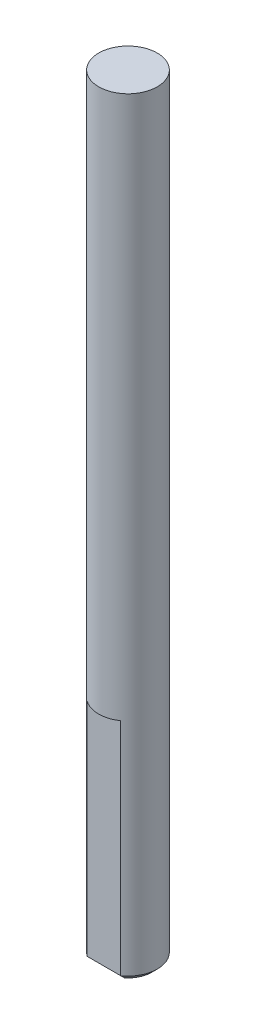
from build123d import *

# Parameters (mm, degrees)
BOSS_EXTRUDE1_DEPTH = 69
CUT_EXTRUDE1_DEPTH  = 20.3
CHAMFER1_SIZE       = 0.5


with BuildPart() as part:
    # Sketch1 → Boss-Extrude1 (new body)
    with BuildSketch(Plane(origin=(0, 0, 0), x_dir=(1, 0, 0), z_dir=(0, 1, 0))):
        with BuildLine():
            ThreePointArc((2.625, 0), (-1.215138881, 2.326813809), (-1.5, -2.154210992))
            Line((-1.5, -2.154210992), (1.5, -2.154210992))
            ThreePointArc((1.5, -2.154210992), (2.326813809, -1.215138881), (2.625, 0))
        make_face()
        with BuildLine():
            Line((1.5, -2.154210992), (-1.5, -2.154210992))
            ThreePointArc((-1.5, -2.154210992), (0, -2.625), (1.5, -2.154210992))
        make_face()
    extrude(amount=BOSS_EXTRUDE1_DEPTH)

    # Sketch1<3> → Cut-Extrude1 (cut)
    with BuildSketch(Plane(origin=(0, 0, 0), x_dir=(1, 0, 0), z_dir=(0, 1, 0))):
        with BuildLine():
            Line((1.5, -2.154210992), (-1.5, -2.154210992))
            ThreePointArc((-1.5, -2.154210992), (0, -2.625), (1.5, -2.154210992))
        make_face()
    extrude(amount=CUT_EXTRUDE1_DEPTH, mode=Mode.SUBTRACT)

    # Chamfer1
    # the kernel refuses this chamfer: 0.5 mm, written as the material it takes off along each edge
    with BuildSketch(Plane(origin=(2.785841494, 0, 2.154210992), x_dir=(0, 0.9996219169112968, 0.027495876610586494), z_dir=(-1, 0, 0))) as chamfer1_piece_1:
        Polygon((CHAMFER1_SIZE * 0.999621916911, CHAMFER1_SIZE * 0.0274958766106), (-CHAMFER1_SIZE * 0.0274958766106, CHAMFER1_SIZE * 0.999621916911), (0, 0), align=None)
    extrude(amount=5.571682988, mode=Mode.SUBTRACT)
    with BuildSketch(Plane(origin=(0, 0, 0), x_dir=(0.11608616482785569, 0, 0.9932391465984212), z_dir=(-0.9932391465984212, 0, 0.11608616482785569))) as chamfer1_piece_2:
        Polygon((2.625, CHAMFER1_SIZE), (2.625 - CHAMFER1_SIZE, 0), (2.625, 0), align=None)
    revolve(axis=Axis((0, 0, 0), (0, 1, 0)), revolution_arc=346.667445344, mode=Mode.SUBTRACT)


solid = part.part
